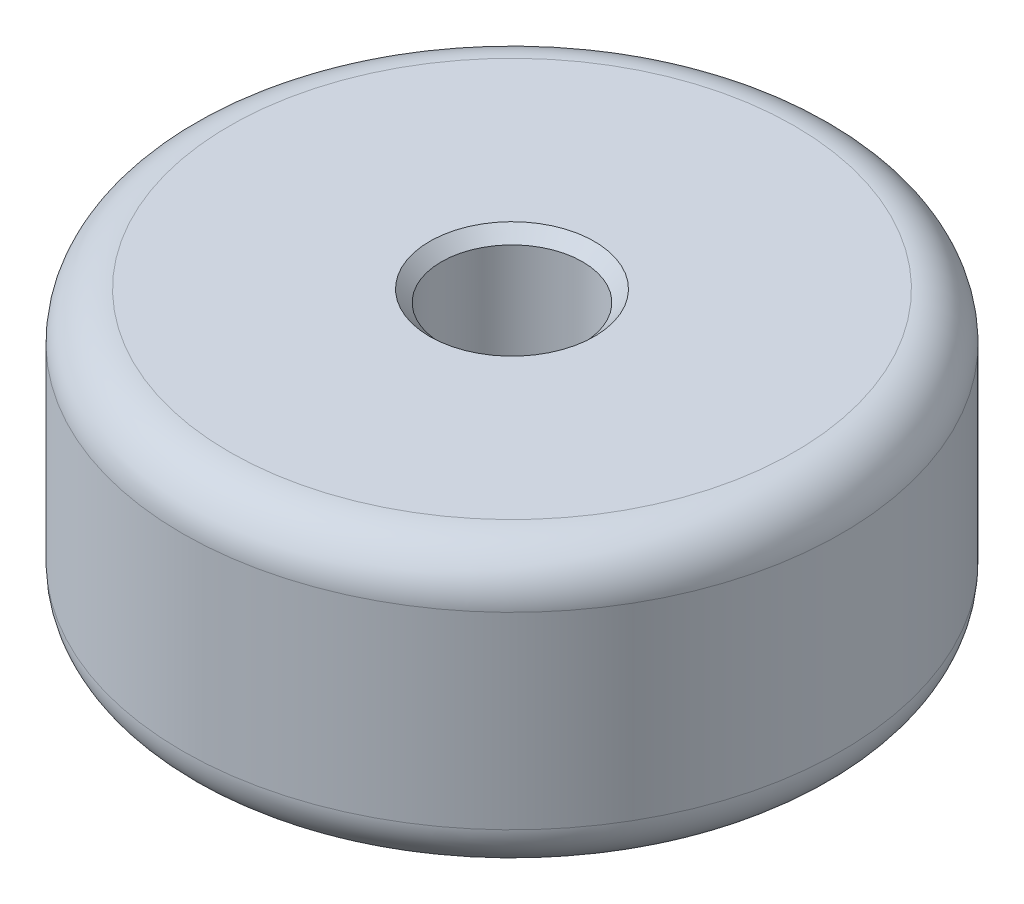
from build123d import *

# Parameters (mm, degrees)
SKETCH1_R           = 11.1125
SKETCH1_R_2         = 2.38125
BOSS_EXTRUDE1_DEPTH = 9.525
FILLET2_R           = 1.5875
CHAMFER2_SIZE       = 0.396875


with BuildPart() as part:
    # Sketch1 → Boss-Extrude1 (new body)
    with BuildSketch(Plane(origin=(0, 0, 0), x_dir=(1, 0, 0), z_dir=(0, 1, 0))):
        Circle(SKETCH1_R)
        Circle(SKETCH1_R_2, mode=Mode.SUBTRACT)
    extrude(amount=BOSS_EXTRUDE1_DEPTH)

    # Fillet2
    fillet2_edges = [part.edges().sort_by_distance(p)[0] for p in [
        (-11.1125, 0, 0),
        (-11.1125, 9.525, 0),
    ]]
    fillet(fillet2_edges, radius=FILLET2_R)

    # Chamfer2
    chamfer2_edges = [part.edges().sort_by_distance(p)[0] for p in [
        (-2.38125, 0, 0),
        (-2.38125, 9.525, 0),
    ]]
    chamfer(chamfer2_edges, length=CHAMFER2_SIZE)


solid = part.part
